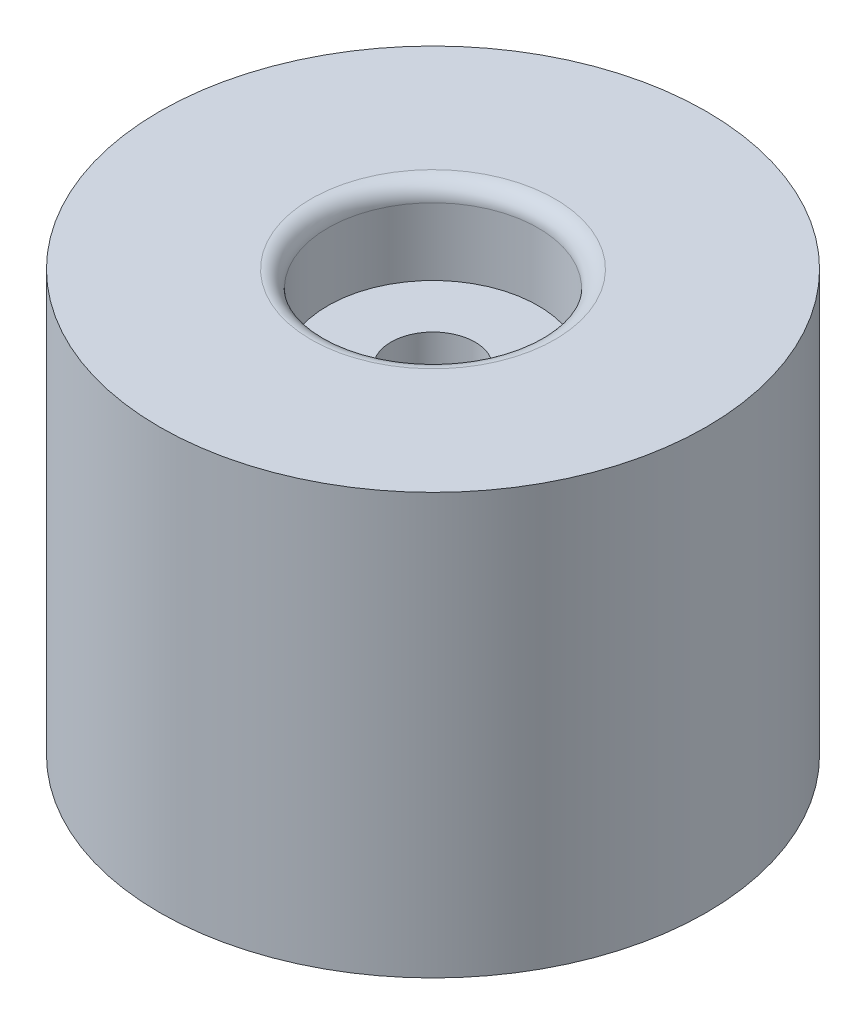
from build123d import *

# Parameters (mm, degrees)
SKETCH1_R           = 6.5
BOSS_EXTRUDE1_DEPTH = 6
SKETCH3_R           = 6.5
SKETCH3_R_2         = 1
BOSS_EXTRUDE2_DEPTH = 4
SKETCH4_R           = 2.5
CUT_EXTRUDE1_DEPTH  = 2
FILLET1_R           = 0.4


with BuildPart() as part:
    # Sketch1 → Boss-Extrude1 (new body)
    with BuildSketch(Plane(origin=(0, 0, 0), x_dir=(1, 0, 0), z_dir=(0, 1, 0))):
        Circle(SKETCH1_R)
        Polygon((5.05, -2.915618859), (5.05, 2.915618859), (0, 5.831237719), (-5.05, 2.915618859), (-5.05, -2.915618859), (0, -5.831237719), align=None, mode=Mode.SUBTRACT)
    extrude(amount=BOSS_EXTRUDE1_DEPTH)

    # Sketch3 → Boss-Extrude2 (add)
    with BuildSketch(Plane(origin=(0, 6, 0), x_dir=(1, 0, 0), z_dir=(0, 1, 0))):
        Circle(SKETCH3_R)
        Circle(SKETCH3_R_2, mode=Mode.SUBTRACT)
    extrude(amount=BOSS_EXTRUDE2_DEPTH)

    # Sketch4 → Cut-Extrude1 (cut)
    with BuildSketch(Plane(origin=(0, 10, 0), x_dir=(1, 0, 0), z_dir=(0, 1, 0))):
        Circle(SKETCH4_R)
    extrude(amount=-CUT_EXTRUDE1_DEPTH, mode=Mode.SUBTRACT)

    # Fillet1
    fillet1_edges = [part.edges().sort_by_distance(p)[0] for p in [
        (-2.5, 10, 0),
    ]]
    fillet(fillet1_edges, radius=FILLET1_R)


solid = part.part
